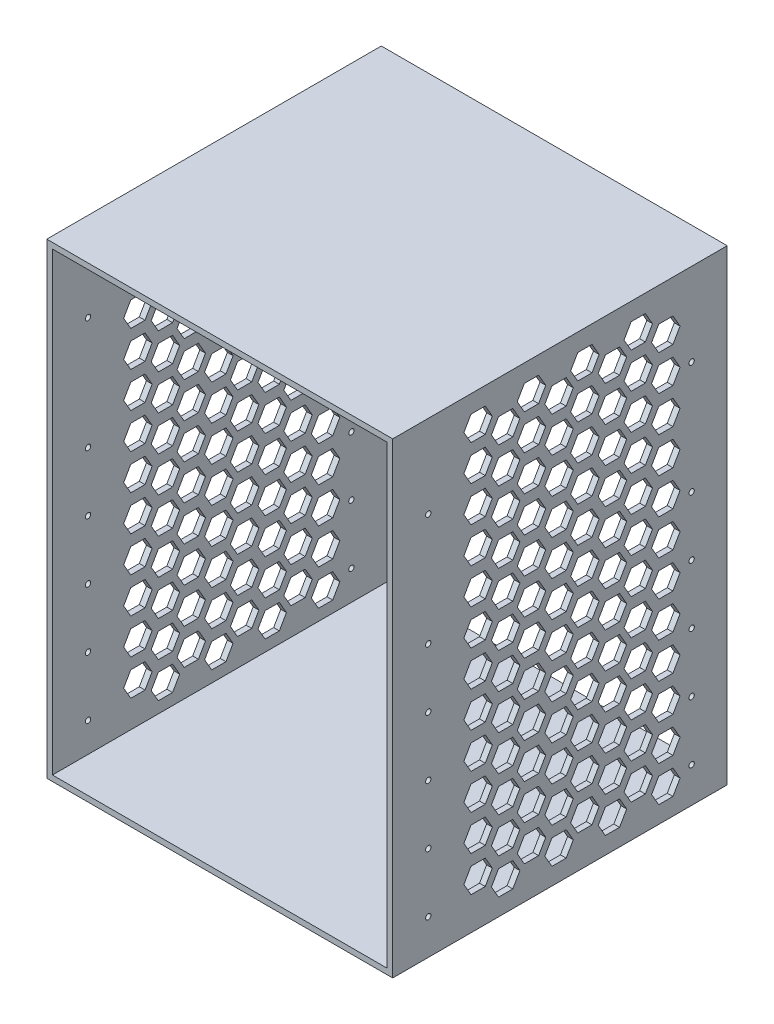
from build123d import *

# Parameters (mm, degrees)
SKETCH1_W            = 97.2
SKETCH1_H            = 131.2
SKETCH1_W_2          = 94
SKETCH1_H_2          = 128
BOSS_EXTRUDE1_DEPTH  = 94
SKETCH2_R            = 0.75
CUT_EXTRUDE1_DEPTH   = 100
CUT_EXTRUDE4_DEPTH   = 100
LPATTERN2_COUNT      = 4
LPATTERN2_PITCH      = 15
LPATTERN2_COUNT_DIR2 = 12
LPATTERN2_PITCH_DIR2 = 10


with BuildPart() as part:
    # Sketch1 → Boss-Extrude1 (new body)
    with BuildSketch(Plane.XY):
        with Locations((4.305046059, -37.15998137)):
            Rectangle(SKETCH1_W, SKETCH1_H)
        with Locations((4.305046059, -37.15998137)):
            Rectangle(SKETCH1_W_2, SKETCH1_H_2, mode=Mode.SUBTRACT)
    extrude(amount=BOSS_EXTRUDE1_DEPTH)

    # Sketch2 → Cut-Extrude1 (cut)
    with BuildSketch(Plane(origin=(52.905046059, 0, 0), x_dir=(0, 0, -1), z_dir=(1, 0, 0))):
        with Locations((-10, -26.45998137)):
            Circle(SKETCH2_R)
        with Locations((-84, -26.45998137)):
            Circle(SKETCH2_R)
        with Locations((-10, -43.05998137)):
            Circle(SKETCH2_R)
        with Locations((-84, -43.05998137)):
            Circle(SKETCH2_R)
        with Locations((-10, -59.65998137)):
            Circle(SKETCH2_R)
        with Locations((-84, -59.65998137)):
            Circle(SKETCH2_R)
        with Locations((-10, -76.25998137)):
            Circle(SKETCH2_R)
        with Locations((-84, -76.25998137)):
            Circle(SKETCH2_R)
        with Locations((-10, -92.85998137)):
            Circle(SKETCH2_R)
        with Locations((-84, -92.85998137)):
            Circle(SKETCH2_R)
        with Locations((-10, 5.14001863)):
            Circle(SKETCH2_R)
        with Locations((-84, 5.14001863)):
            Circle(SKETCH2_R)
    extrude(amount=-CUT_EXTRUDE1_DEPTH, mode=Mode.SUBTRACT)

    # Sketch6 → Cut-Extrude4 (cut)
    with BuildSketch(Plane(origin=(52.905046059, 0, 0), x_dir=(0, 0, -1), z_dir=(1, 0, 0))):
        Polygon((-74, 19.975917015), (-72, 23.44001863), (-68, 23.44001863), (-66, 19.975917015), (-68, 16.5118154), (-72, 16.5118154), align=None)
        Polygon((-66.255693118, 15.504739352), (-64.255693118, 18.968840967), (-60.255693118, 18.968840967), (-58.255693118, 15.504739352), (-60.255693118, 12.040637737), (-64.255693118, 12.040637737), align=None)
    cut_extrude4 = extrude(amount=-CUT_EXTRUDE4_DEPTH, mode=Mode.SUBTRACT)

    # LPattern2: Cut-Extrude4 4 × 12
    with Locations(*[(0, -j * LPATTERN2_PITCH_DIR2, -i * LPATTERN2_PITCH) for i in range(LPATTERN2_COUNT) for j in range(LPATTERN2_COUNT_DIR2) if (i, j) != (0, 0)]):
        add(cut_extrude4, mode=Mode.SUBTRACT)


solid = part.part
